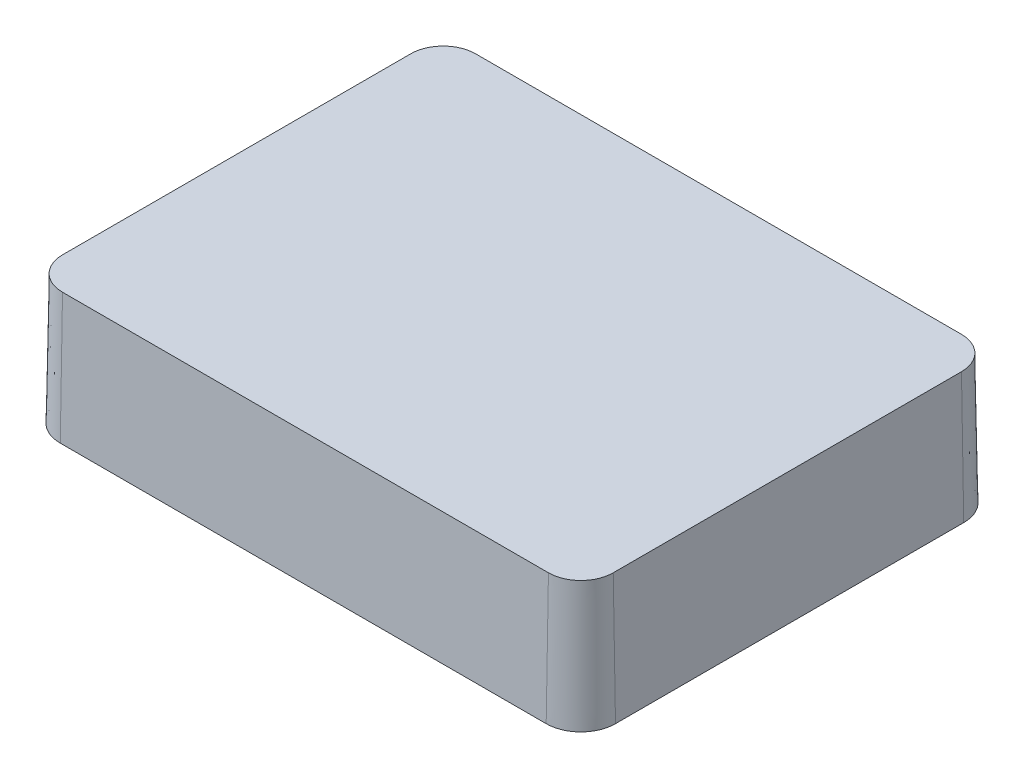
from build123d import *

# Parameters (mm, degrees)
BOSS_EXTRUDE1_DEPTH = 4
BOSS_EXTRUDE1_DRAFT = 1
SHELL1_T            = -0.5
SKETCH2_R           = 2
BOSS_EXTRUDE2_DEPTH = 5.5
BOSS_EXTRUDE2_TAPER = 1.5
CIRPATTERN1_COUNT   = 4
SKETCH4_R           = 1.605977431
CUT_EXTRUDE1_DEPTH  = 5.5
CUT_EXTRUDE1_DRAFT  = 1.5


with BuildPart() as part:
    # Sketch1 → Boss-Extrude1 (with draft: the straight prism first)
    with BuildSketch(Plane(origin=(0, 0, 0), x_dir=(1, 0, 0), z_dir=(0, 1, 0))):
        with BuildLine():
            Line((-7.5, -6.375), (7.5, -6.375))
            ThreePointArc((7.5, -6.375), (8.207106781, -6.082106781), (8.5, -5.375))
            Line((8.5, -5.375), (8.5, 5.375))
            ThreePointArc((8.5, 5.375), (8.207106781, 6.082106781), (7.5, 6.375))
            Line((7.5, 6.375), (-7.5, 6.375))
            ThreePointArc((-7.5, 6.375), (-8.207106781, 6.082106781), (-8.5, 5.375))
            Line((-8.5, 5.375), (-8.5, -5.375))
            ThreePointArc((-8.5, -5.375), (-8.207106781, -6.082106781), (-7.5, -6.375))
        make_face()
    extrude(amount=-BOSS_EXTRUDE1_DEPTH)
    # Boss-Extrude1: the draft: its side faces are tilted about the plane it starts from
    boss_extrude1_sides = [part.faces().sort_by_distance(p)[0] for p in [
        (0, -2, 6.375),
        (8.207106781, -2, 6.082106781),
        (8.5, -2, 0),
        (8.207106781, -2, -6.082106781),
        (0, -2, -6.375),
        (-8.207106781, -2, -6.082106781),
        (-8.5, -2, 0),
        (-8.207106781, -2, 6.082106781),
    ]]
    draft(boss_extrude1_sides, Plane(origin=(0, 0, 0), x_dir=(1, 0, 0), z_dir=(0, 1, 0)), BOSS_EXTRUDE1_DRAFT)

    # Shell1
    shell1_openings = [part.faces().sort_by_distance(p)[0] for p in [
        (0, -4, 0),
    ]]
    offset(amount=SHELL1_T, openings=shell1_openings, kind=Kind.INTERSECTION)

    # Sketch2 → Boss-Extrude2 (add)
    with BuildSketch(Plane.XZ.offset(0.5)):
        Circle(SKETCH2_R)
    extrude(amount=BOSS_EXTRUDE2_DEPTH, taper=BOSS_EXTRUDE2_TAPER)

    # Rib1: read off the stored shape, not the designer's step
    # Rib1: loft between two sections, ruled curve by curve
    rib1_from = [
        Edge.make_line((1.98200868, -0.5, 0.267659472), (3, -0.5, 0.25)),
        Edge.make_line((1.98200868, -0.5, -0.267659472), (3, -0.5, -0.25)),
        Edge.make_line((3, -0.5, -0.25), (3, -0.5, 0.25)),
        Edge.make_line((1.98200868, -0.5, -0.267659472), (1.98200868, -0.5, 0.267659472)),
    ]
    rib1_to = [
        Edge.make_line((1.837744445, -6, 0.259514127), (2.386192277, -6, 0.25)),
        Edge.make_line((1.837744445, -6, -0.259514127), (2.386192277, -6, -0.25)),
        Edge.make_line((2.386192277, -6, -0.25), (2.386192277, -6, 0.25)),
        Edge.make_line((1.837744445, -6, -0.259514127), (1.837744445, -6, 0.259514127)),
    ]
    rib1 = Solid(Shell([*[Face.make_surface_from_curves(rib1_from[k], rib1_to[k]) for k in range(4)], Face(Wire(rib1_from)), Face(Wire(rib1_to))]))
    add(rib1)

    # CirPattern1: Rib1 ×4 about axis
    cirpattern1_axis = Axis((0, 0, 0), (0, 1, 0))
    for i in range(1, CIRPATTERN1_COUNT):
        add(rib1.rotate(cirpattern1_axis, i * 360 / CIRPATTERN1_COUNT))


with BuildPart() as cut_extrude1_tool:
    # Sketch4 → Cut-Extrude1 (with draft: the straight prism first)
    with BuildSketch(Plane.XZ.offset(6)):
        Circle(SKETCH4_R)
    extrude(amount=-CUT_EXTRUDE1_DEPTH)
    # Cut-Extrude1: the draft: its side faces are tilted about the plane it starts from
    cut_extrude1_sides = [cut_extrude1_tool.faces().sort_by_distance(p)[0] for p in [
        (-1.605977431, -3.25, 0),
    ]]
    draft(cut_extrude1_sides, Plane.XZ.offset(6), CUT_EXTRUDE1_DRAFT)


with BuildPart() as part_1:
    add(part.part)

    # Cut-Extrude1: cut by cut_extrude1_tool
    add(cut_extrude1_tool.part, mode=Mode.SUBTRACT)


solid = part_1.part
